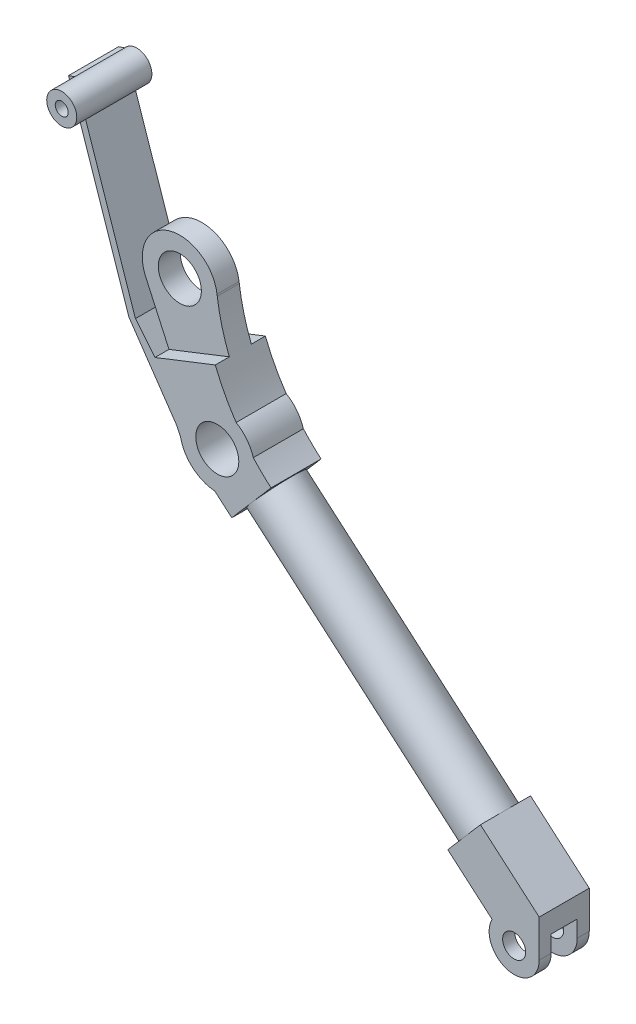
from build123d import *

# Parameters (mm, degrees)
SKETCH1_R               = 3.748314074
SKETCH1_R_2             = 2.15
BOSS_EXTRUDE1_DEPTH     = 1.1
BOSS_EXTRUDE2_START     = -2.5
BOSS_EXTRUDE2_DEPTH     = 5
SKETCH3_R               = 2.5
BOSS_EXTRUDE3_DEPTH     = 30.5
BOSS_EXTRUDE4_REACH     = 66.583
CUT_EXTRUDE1_DEPTH      = 77.014827373
CUT_EXTRUDE1_DEPTH_BACK = 77.014827373
SKETCH5_R               = 2.15
SKETCH6_R               = 1.15
BOSS_EXTRUDE5_DEPTH     = 2.5
SKETCH7_R               = 3
CUT_EXTRUDE2_DEPTH      = 1.3
BOSS_EXTRUDE6_START     = -7.5
SKETCH8_R               = 1.5
BOSS_EXTRUDE6_DEPTH     = 7.5
CUT_EXTRUDE3_DEPTH      = 77.681407452
CUT_EXTRUDE3_DEPTH_BACK = 77.681407452
SKETCH9_R               = 0.65


with BuildPart() as part:
    # Sketch1 → Boss-Extrude1 (new, symmetric)
    # profile 1 of 2: a face of its own
    with BuildSketch(Plane.XY):
        with BuildLine():
            Line((-29.007745084, 30.523910578), (-25.091893995, 35.069909945))
            ThreePointArc((-25.091893995, 35.069909945), (-29.621942143, 40.692126277), (-31.860472098, 47.55650071))
            Line((-31.860472098, 47.55650071), (-31.88258847, 47.720887837))
            ThreePointArc((-31.88258847, 47.720887837), (-31.857495615, 47.471553034), (-31.84911885, 47.221098797))
            ThreePointArc((-31.84911885, 47.221098797), (-34.80303687, 43.557931682), (-39.009027568, 45.6683978))
            Line((-39.009027568, 45.6683978), (-34.12097225, 34.928362615))
            Line((-34.12097225, 34.928362615), (-29.007745084, 30.523910578))
        make_face()
    # profile 2 of 2: a face of its own
    with BuildSketch(Plane.XY):
        with Locations((-35.597432924, 47.221098797)):
            Circle(SKETCH1_R)
        with Locations((-35.597432924, 47.221098797)):
            Circle(SKETCH1_R_2, mode=Mode.SUBTRACT)
    extrude(amount=BOSS_EXTRUDE1_DEPTH, both=True)

    # Boss-Extrude2: read off the stored shape, not the designer's step
    # Boss-Extrude2 outline → Boss-Extrude2 (add)
    with BuildSketch(Plane.XY.offset(BOSS_EXTRUDE2_START)):
        with BuildLine():
            ThreePointArc((-25.091893995, 35.069909945), (-26.003854199, 35.905963494), (-26.862376119, 36.796804144))
            ThreePointArc((-26.862376119, 36.796804144), (-27.511007835, 38.051535597), (-28.577777167, 38.977320299))
            ThreePointArc((-28.577777167, 38.977320299), (-29.726956647, 40.888456377), (-30.656228901, 42.915648441))
            Line((-30.656228901, 42.915648441), (-36.680056275, 40.551182055))
            Line((-36.680056275, 40.551182055), (-34.12097225, 34.928362615))
            ThreePointArc((-34.12097225, 34.928362615), (-32.905703874, 32.891668535), (-30.711472725, 31.991474297))
            Line((-30.711472725, 31.991474297), (-29.007745084, 30.523910578))
            Line((-29.007745084, 30.523910578), (-25.091893995, 35.069909945))
        make_face()
    extrude(amount=BOSS_EXTRUDE2_DEPTH)

    # Sketch3 → Boss-Extrude3 (add)
    with BuildSketch(Plane(origin=(-31.745759068, 27.345288728, 0), x_dir=(0, 0, -1), z_dir=(0.7576665611269928, -0.6526418482981281, 0))):
        with Locations((0, 7.195277993)):
            Circle(SKETCH3_R)
    extrude(amount=BOSS_EXTRUDE3_DEPTH)

    # Boss-Extrude4: up to this face of the body (flat: up to its plane)
    boss_extrude4_end = Plane(part.part.faces().sort_by_distance((-30.992912772, 36.816549457, 2.5))[0])
    # Sketch4 → Boss-Extrude4 (add, up to the picked face)
    with BuildSketch(Plane(origin=(0, 0, -2.5), x_dir=(-1, 0, 0), z_dir=(0, 0, -1)), mode=Mode.PRIVATE) as boss_extrude4_sk1:
        Polygon((44.67104718, 60.829350293), (38.62968166, 42.935799229), (36.680056275, 40.551182055), (34.487145344, 35.732918139), (39.271055483, 42.725492907), (45.31052994, 60.613442948), align=None)
    boss_extrude4_tool1 = split(extrude(boss_extrude4_sk1.sketch, amount=-BOSS_EXTRUDE4_REACH, mode=Mode.PRIVATE), bisect_by=boss_extrude4_end, keep=Keep.BOTH, mode=Mode.PRIVATE)
    add(boss_extrude4_tool1.solids().sort_by(Axis((-40.62976, 48.582602, -2.5), (0, 0, 1)))[0])

    # Sketch5 → Cut-Extrude1 (cut, two sides: drawn at the far end of the back side and taken through both)
    with BuildSketch(Plane.XY.offset(2.5).offset(-CUT_EXTRUDE1_DEPTH_BACK)):
        with Locations((-30.458296942, 35.732918139)):
            Circle(SKETCH5_R)
    extrude(amount=CUT_EXTRUDE1_DEPTH + CUT_EXTRUDE1_DEPTH_BACK, mode=Mode.SUBTRACT)

    # Sketch6 → Boss-Extrude5 (add, symmetric)
    with BuildSketch(Plane.XY):
        with BuildLine():
            Line((-3.018256327, 8.79690186), (-7.441885155, 12.607344927))
            Line((-7.441885155, 12.607344927), (-4.178675914, 16.395677733))
            Line((-4.178675914, 16.395677733), (1.686549766, 11.343466212))
            Line((1.686549766, 11.343466212), (1.686549766, 7.618415505))
            ThreePointArc((1.686549766, 7.618415505), (-1.420897666, 5.193336616), (-3.018256327, 8.79690186))
        make_face()
        with Locations((-0.813450234, 7.618415505)):
            Circle(SKETCH6_R, mode=Mode.SUBTRACT)
    extrude(amount=BOSS_EXTRUDE5_DEPTH, both=True)

    # Sketch7 → Cut-Extrude2 (cut, symmetric)
    with BuildSketch(Plane.XY):
        with Locations((-0.813450234, 7.618415505)):
            Circle(SKETCH7_R)
    extrude(amount=CUT_EXTRUDE2_DEPTH, both=True, mode=Mode.SUBTRACT)

    # Sketch8 → Boss-Extrude6 (add)
    with BuildSketch(Plane.XY.offset(2.5).offset(BOSS_EXTRUDE6_START)):
        with Locations(Location((-43.488619522, 59.906385053, 0), (0, 0, 255.286714902))):
            Circle(SKETCH8_R)
    extrude(amount=BOSS_EXTRUDE6_DEPTH)

    # Sketch9 → Cut-Extrude3 (cut, two sides: drawn at the far end of the back side and taken through both)
    with BuildSketch(Plane.XY.offset(2.5).offset(-CUT_EXTRUDE3_DEPTH_BACK)):
        with Locations((-43.488619522, 59.906385053)):
            Circle(SKETCH9_R)
    extrude(amount=CUT_EXTRUDE3_DEPTH + CUT_EXTRUDE3_DEPTH_BACK, mode=Mode.SUBTRACT)


with BuildPart() as part_1:
    # Body-Move/Copy1: moved
    add(part.part.moved(Location((35.6, -47.22, 0))))


with BuildPart() as body_2:
    # Split1: read off the stored shape, not the designer's step
    # Split1: the piece on the far side of the plane
    add(part_1.part)
    split(bisect_by=Plane.XY.offset(-2.5), keep=Keep.BOTTOM)


with BuildPart() as part_2:
    add(part_1.part)

    # Split1
    split(bisect_by=Plane.XY.offset(-2.5), keep=Keep.TOP)


with BuildPart() as body_2_1:
    # Body-Move/Copy2: read off the stored shape, not the designer's step
    # Body-Move/Copy2: moved
    add(body_2.part.moved(Location((0, 0, 7.5))))


with BuildPart() as part_3:
    add(part_2.part)

    # Combine1: read off the stored shape, not the designer's step
    # Combine1: union body 2
    add(body_2_1.part)


solid = part_3.part
